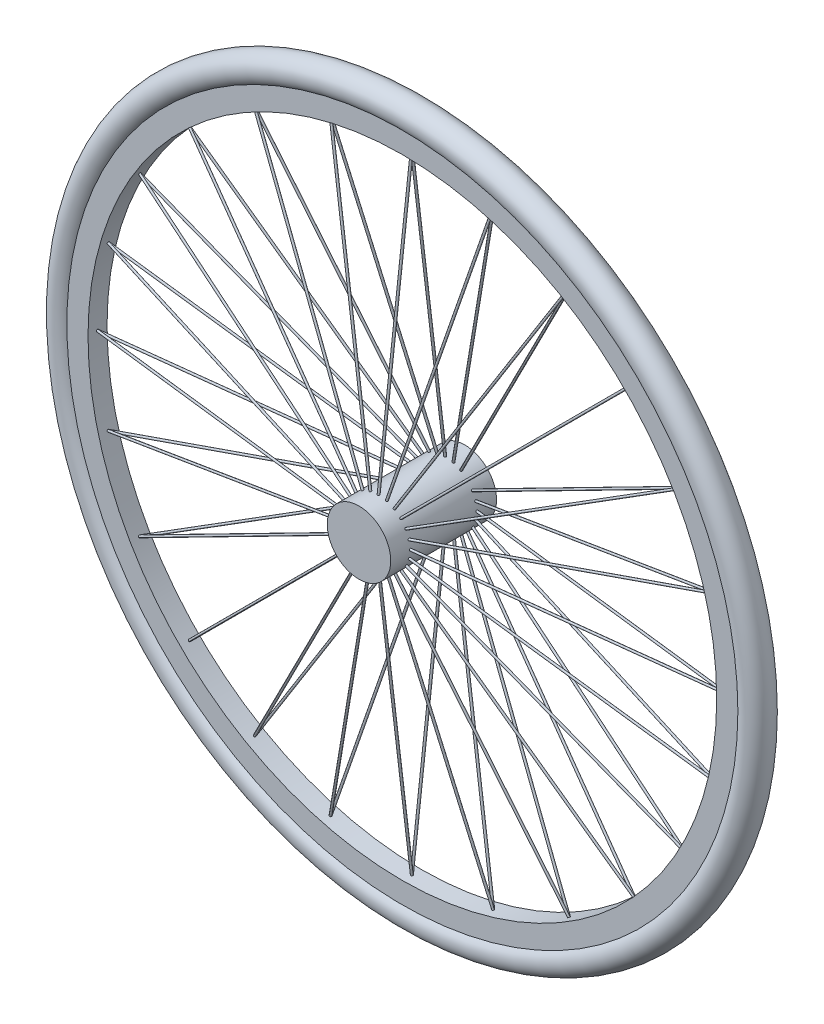
from build123d import *

# Parameters (mm, degrees)
SKETCH_1_R                  = 30
EXTRUDE_1_DEPTH             = 50
EXTRUDE_2_REACH             = 490.288
EXTRUDE_2_END_RADIUS        = 297.143913836
SKETCH_6_R                  = 1
PATTERN_CIRCULAR_1_COUNT    = 24
MIRROR_1_COPY_1_REACH       = 490.288
MIRROR_1_COPY_1_END_RADIUS  = 297.143913836
MIRROR_1_COPY_1_SKETCH_R    = 1
MIRROR_1_COPY_2_REACH       = 490.288
MIRROR_1_COPY_2_END_RADIUS  = 297.143913836
MIRROR_1_COPY_2_SKETCH_R    = 1
MIRROR_1_COPY_3_REACH       = 490.288
MIRROR_1_COPY_3_END_RADIUS  = 297.143913836
MIRROR_1_COPY_3_SKETCH_R    = 1
MIRROR_1_COPY_4_REACH       = 490.288
MIRROR_1_COPY_4_END_RADIUS  = 297.143913836
MIRROR_1_COPY_4_SKETCH_R    = 1
MIRROR_1_COPY_5_REACH       = 490.288
MIRROR_1_COPY_5_END_RADIUS  = 297.143913836
MIRROR_1_COPY_5_SKETCH_R    = 1
MIRROR_1_COPY_6_REACH       = 490.288
MIRROR_1_COPY_6_END_RADIUS  = 297.143913836
MIRROR_1_COPY_6_SKETCH_R    = 1
MIRROR_1_COPY_7_REACH       = 490.288
MIRROR_1_COPY_7_END_RADIUS  = 297.143913836
MIRROR_1_COPY_7_SKETCH_R    = 1
MIRROR_1_COPY_8_REACH       = 490.288
MIRROR_1_COPY_8_END_RADIUS  = 297.143913836
MIRROR_1_COPY_8_SKETCH_R    = 1
MIRROR_1_COPY_9_REACH       = 490.288
MIRROR_1_COPY_9_END_RADIUS  = 297.143913836
MIRROR_1_COPY_9_SKETCH_R    = 1
MIRROR_1_COPY_10_REACH      = 490.288
MIRROR_1_COPY_10_END_RADIUS = 297.143913836
MIRROR_1_COPY_10_SKETCH_R   = 1
MIRROR_1_COPY_11_REACH      = 490.288
MIRROR_1_COPY_11_END_RADIUS = 297.143913836
MIRROR_1_COPY_11_SKETCH_R   = 1
MIRROR_1_COPY_12_REACH      = 490.288
MIRROR_1_COPY_12_END_RADIUS = 297.143913836
MIRROR_1_COPY_12_SKETCH_R   = 1
MIRROR_1_COPY_13_REACH      = 490.288
MIRROR_1_COPY_13_END_RADIUS = 297.143913836
MIRROR_1_COPY_13_SKETCH_R   = 1
MIRROR_1_COPY_14_REACH      = 490.288
MIRROR_1_COPY_14_END_RADIUS = 297.143913836
MIRROR_1_COPY_14_SKETCH_R   = 1
MIRROR_1_COPY_15_REACH      = 490.288
MIRROR_1_COPY_15_END_RADIUS = 297.143913836
MIRROR_1_COPY_15_SKETCH_R   = 1
MIRROR_1_COPY_16_REACH      = 490.288
MIRROR_1_COPY_16_END_RADIUS = 297.143913836
MIRROR_1_COPY_16_SKETCH_R   = 1
MIRROR_1_COPY_17_REACH      = 490.288
MIRROR_1_COPY_17_END_RADIUS = 297.143913836
MIRROR_1_COPY_17_SKETCH_R   = 1
MIRROR_1_COPY_18_REACH      = 490.288
MIRROR_1_COPY_18_END_RADIUS = 297.143913836
MIRROR_1_COPY_18_SKETCH_R   = 1
MIRROR_1_COPY_19_REACH      = 490.288
MIRROR_1_COPY_19_END_RADIUS = 297.143913836
MIRROR_1_COPY_19_SKETCH_R   = 1
MIRROR_1_COPY_20_REACH      = 490.288
MIRROR_1_COPY_20_END_RADIUS = 297.143913836
MIRROR_1_COPY_20_SKETCH_R   = 1
MIRROR_1_COPY_21_REACH      = 490.288
MIRROR_1_COPY_21_END_RADIUS = 297.143913836
MIRROR_1_COPY_21_SKETCH_R   = 1
MIRROR_1_COPY_22_REACH      = 490.288
MIRROR_1_COPY_22_END_RADIUS = 297.143913836
MIRROR_1_COPY_22_SKETCH_R   = 1
MIRROR_1_COPY_23_REACH      = 490.288
MIRROR_1_COPY_23_END_RADIUS = 297.143913836
MIRROR_1_COPY_23_SKETCH_R   = 1
MIRROR_1_COPY_24_REACH      = 490.288
MIRROR_1_COPY_24_END_RADIUS = 297.143913836
MIRROR_1_COPY_24_SKETCH_R   = 1


with BuildPart() as part:
    # 草图1 → 凸台-拉伸1 (new, symmetric)
    with BuildSketch(Plane.XY):
        Circle(SKETCH_1_R)
    extrude(amount=EXTRUDE_1_DEPTH, both=True)



with BuildPart() as body_2:
    # 草图2 → 旋转1 (revolve)
    with BuildSketch(Plane(origin=(0, 0, 0), x_dir=(1, 0, 0), z_dir=(0, 1, 0))):
        with BuildLine():
            Line((297.143913836, 9), (317.143913836, 9))
            ThreePointArc((317.143913836, 9), (340, 0), (317.143913836, -9))
            Line((317.143913836, -9), (297.143913836, -9))
            Line((297.143913836, -9), (297.143913836, 9))
        make_face()
    revolve(axis=Axis((0, 0, 50), (0, 0, -1)))


with BuildPart() as part_1:
    add(part.part)

    add(body_2.part)  # 凸台-拉伸2 merges body 2
    # 凸台-拉伸2: up to this cylinder (the profile starts inside it)
    extrude_2_end = Plane(origin=(0, 0, 35), z_dir=(0, 0, 1)) * Cylinder(EXTRUDE_2_END_RADIUS, 1575.863827673, mode=Mode.PRIVATE)
    # 草图6 → 凸台-拉伸2 (add, up to the surface)
    with BuildSketch(Plane(origin=(0, 0, 35), x_dir=(-0.11697935085130698, 0, -0.9931343471426245), z_dir=(0.9931343471426245, 0, -0.11697935085130698)), mode=Mode.PRIVATE) as extrude_2_sk1:
        Circle(SKETCH_6_R)
    extrude_2_tool1 = extrude(extrude_2_sk1.sketch, amount=EXTRUDE_2_REACH, mode=Mode.PRIVATE) & extrude_2_end
    extrude_2 = extrude_2_tool1.solids().sort_by_distance((0, 0, 35))[0]
    add(extrude_2)

    # 阵列(圆周)1: 凸台-拉伸2 ×24 about axis
    pattern_circular_1_axis = Axis((0, 0, 50), (0, 0, 1))
    for i in range(1, PATTERN_CIRCULAR_1_COUNT):
        add(extrude_2.rotate(pattern_circular_1_axis, i * 360 / PATTERN_CIRCULAR_1_COUNT))

    # 镜向1 copy 1: up to this cylinder (the profile starts inside it)
    mirror_1_copy_1_end = Plane(origin=(0, 0, 35), z_dir=(0, 0, 1)) * Cylinder(MIRROR_1_COPY_1_END_RADIUS, 1575.863827673, mode=Mode.PRIVATE)
    # 镜向1 copy 1 sketch → 镜向1 copy 1 (add, up to the surface)
    with BuildSketch(Plane(origin=(0, 0, -35), x_dir=(-0.11299337612980752, -0.03027648388404802, 0.9931343471426245), z_dir=(0.959294114879794, 0.2570420833859694, 0.11697935085130698)), mode=Mode.PRIVATE) as mirror_1_copy_1_sk1:
        Circle(MIRROR_1_COPY_1_SKETCH_R)
    mirror_1_copy_1_tool1 = extrude(mirror_1_copy_1_sk1.sketch, amount=MIRROR_1_COPY_1_REACH, mode=Mode.PRIVATE) & mirror_1_copy_1_end
    add(mirror_1_copy_1_tool1.solids().sort_by_distance((0, 0, 35))[0])

    # 镜向1 copy 2: up to this cylinder (the profile starts inside it)
    mirror_1_copy_2_end = Plane(origin=(0, 0, 35), z_dir=(0, 0, 1)) * Cylinder(MIRROR_1_COPY_2_END_RADIUS, 1575.863827673, mode=Mode.PRIVATE)
    # 镜向1 copy 2 sketch → 镜向1 copy 2 (add, up to the surface)
    with BuildSketch(Plane(origin=(0, 0, -35), x_dir=(-0.10130708955544465, -0.05848967542565348, 0.9931343471426245), z_dir=(0.8600795739963863, 0.4965671735713122, 0.11697935085130698)), mode=Mode.PRIVATE) as mirror_1_copy_2_sk1:
        Circle(MIRROR_1_COPY_2_SKETCH_R)
    mirror_1_copy_2_tool1 = extrude(mirror_1_copy_2_sk1.sketch, amount=MIRROR_1_COPY_2_REACH, mode=Mode.PRIVATE) & mirror_1_copy_2_end
    add(mirror_1_copy_2_tool1.solids().sort_by_distance((0, 0, 35))[0])

    # 镜向1 copy 3: up to this cylinder (the profile starts inside it)
    mirror_1_copy_3_end = Plane(origin=(0, 0, 35), z_dir=(0, 0, 1)) * Cylinder(MIRROR_1_COPY_3_END_RADIUS, 1575.863827673, mode=Mode.PRIVATE)
    # 镜向1 copy 3 sketch → 镜向1 copy 3 (add, up to the surface)
    with BuildSketch(Plane(origin=(0, 0, -35), x_dir=(-0.0827168922457595, -0.08271689224575948, 0.9931343471426245), z_dir=(0.7022520314938245, 0.7022520314938244, 0.11697935085130698)), mode=Mode.PRIVATE) as mirror_1_copy_3_sk1:
        Circle(MIRROR_1_COPY_3_SKETCH_R)
    mirror_1_copy_3_tool1 = extrude(mirror_1_copy_3_sk1.sketch, amount=MIRROR_1_COPY_3_REACH, mode=Mode.PRIVATE) & mirror_1_copy_3_end
    add(mirror_1_copy_3_tool1.solids().sort_by_distance((0, 0, 35))[0])

    # 镜向1 copy 4: up to this cylinder (the profile starts inside it)
    mirror_1_copy_4_end = Plane(origin=(0, 0, 35), z_dir=(0, 0, 1)) * Cylinder(MIRROR_1_COPY_4_END_RADIUS, 1575.863827673, mode=Mode.PRIVATE)
    # 镜向1 copy 4 sketch → 镜向1 copy 4 (add, up to the surface)
    with BuildSketch(Plane(origin=(0, 0, -35), x_dir=(-0.0584896754256535, -0.10130708955544464, 0.9931343471426245), z_dir=(0.49656717357131236, 0.8600795739963862, 0.11697935085130698)), mode=Mode.PRIVATE) as mirror_1_copy_4_sk1:
        Circle(MIRROR_1_COPY_4_SKETCH_R)
    mirror_1_copy_4_tool1 = extrude(mirror_1_copy_4_sk1.sketch, amount=MIRROR_1_COPY_4_REACH, mode=Mode.PRIVATE) & mirror_1_copy_4_end
    add(mirror_1_copy_4_tool1.solids().sort_by_distance((0, 0, 35))[0])

    # 镜向1 copy 5: up to this cylinder (the profile starts inside it)
    mirror_1_copy_5_end = Plane(origin=(0, 0, 35), z_dir=(0, 0, 1)) * Cylinder(MIRROR_1_COPY_5_END_RADIUS, 1575.863827673, mode=Mode.PRIVATE)
    # 镜向1 copy 5 sketch → 镜向1 copy 5 (add, up to the surface)
    with BuildSketch(Plane(origin=(0, 0, -35), x_dir=(-0.03027648388404802, -0.11299337612980752, 0.9931343471426245), z_dir=(0.2570420833859694, 0.959294114879794, 0.11697935085130698)), mode=Mode.PRIVATE) as mirror_1_copy_5_sk1:
        Circle(MIRROR_1_COPY_5_SKETCH_R)
    mirror_1_copy_5_tool1 = extrude(mirror_1_copy_5_sk1.sketch, amount=MIRROR_1_COPY_5_REACH, mode=Mode.PRIVATE) & mirror_1_copy_5_end
    add(mirror_1_copy_5_tool1.solids().sort_by_distance((0, 0, 35))[0])

    # 镜向1 copy 6: up to this cylinder (the profile starts inside it)
    mirror_1_copy_6_end = Plane(origin=(0, 0, 35), z_dir=(0, 0, 1)) * Cylinder(MIRROR_1_COPY_6_END_RADIUS, 1575.863827673, mode=Mode.PRIVATE)
    # 镜向1 copy 6 sketch → 镜向1 copy 6 (add, up to the surface)
    with BuildSketch(Plane(origin=(0, 0, -35), x_dir=(0, -0.11697935085130698, 0.9931343471426245), z_dir=(0, 0.9931343471426245, 0.11697935085130698)), mode=Mode.PRIVATE) as mirror_1_copy_6_sk1:
        Circle(MIRROR_1_COPY_6_SKETCH_R)
    mirror_1_copy_6_tool1 = extrude(mirror_1_copy_6_sk1.sketch, amount=MIRROR_1_COPY_6_REACH, mode=Mode.PRIVATE) & mirror_1_copy_6_end
    add(mirror_1_copy_6_tool1.solids().sort_by_distance((0, 0, 35))[0])

    # 镜向1 copy 7: up to this cylinder (the profile starts inside it)
    mirror_1_copy_7_end = Plane(origin=(0, 0, 35), z_dir=(0, 0, 1)) * Cylinder(MIRROR_1_COPY_7_END_RADIUS, 1575.863827673, mode=Mode.PRIVATE)
    # 镜向1 copy 7 sketch → 镜向1 copy 7 (add, up to the surface)
    with BuildSketch(Plane(origin=(0, 0, -35), x_dir=(0.030276483884048033, -0.11299337612980752, 0.9931343471426244), z_dir=(-0.2570420833859695, 0.959294114879794, 0.11697935085130697)), mode=Mode.PRIVATE) as mirror_1_copy_7_sk1:
        Circle(MIRROR_1_COPY_7_SKETCH_R)
    mirror_1_copy_7_tool1 = extrude(mirror_1_copy_7_sk1.sketch, amount=MIRROR_1_COPY_7_REACH, mode=Mode.PRIVATE) & mirror_1_copy_7_end
    add(mirror_1_copy_7_tool1.solids().sort_by_distance((0, 0, 35))[0])

    # 镜向1 copy 8: up to this cylinder (the profile starts inside it)
    mirror_1_copy_8_end = Plane(origin=(0, 0, 35), z_dir=(0, 0, 1)) * Cylinder(MIRROR_1_COPY_8_END_RADIUS, 1575.863827673, mode=Mode.PRIVATE)
    # 镜向1 copy 8 sketch → 镜向1 copy 8 (add, up to the surface)
    with BuildSketch(Plane(origin=(0, 0, -35), x_dir=(0.05848967542565346, -0.10130708955544465, 0.9931343471426245), z_dir=(-0.496567173571312, 0.8600795739963863, 0.11697935085130698)), mode=Mode.PRIVATE) as mirror_1_copy_8_sk1:
        Circle(MIRROR_1_COPY_8_SKETCH_R)
    mirror_1_copy_8_tool1 = extrude(mirror_1_copy_8_sk1.sketch, amount=MIRROR_1_COPY_8_REACH, mode=Mode.PRIVATE) & mirror_1_copy_8_end
    add(mirror_1_copy_8_tool1.solids().sort_by_distance((0, 0, 35))[0])

    # 镜向1 copy 9: up to this cylinder (the profile starts inside it)
    mirror_1_copy_9_end = Plane(origin=(0, 0, 35), z_dir=(0, 0, 1)) * Cylinder(MIRROR_1_COPY_9_END_RADIUS, 1575.863827673, mode=Mode.PRIVATE)
    # 镜向1 copy 9 sketch → 镜向1 copy 9 (add, up to the surface)
    with BuildSketch(Plane(origin=(0, 0, -35), x_dir=(0.08271689224575948, -0.0827168922457595, 0.9931343471426245), z_dir=(-0.7022520314938244, 0.7022520314938245, 0.11697935085130698)), mode=Mode.PRIVATE) as mirror_1_copy_9_sk1:
        Circle(MIRROR_1_COPY_9_SKETCH_R)
    mirror_1_copy_9_tool1 = extrude(mirror_1_copy_9_sk1.sketch, amount=MIRROR_1_COPY_9_REACH, mode=Mode.PRIVATE) & mirror_1_copy_9_end
    add(mirror_1_copy_9_tool1.solids().sort_by_distance((0, 0, 35))[0])

    # 镜向1 copy 10: up to this cylinder (the profile starts inside it)
    mirror_1_copy_10_end = Plane(origin=(0, 0, 35), z_dir=(0, 0, 1)) * Cylinder(MIRROR_1_COPY_10_END_RADIUS, 1575.863827673, mode=Mode.PRIVATE)
    # 镜向1 copy 10 sketch → 镜向1 copy 10 (add, up to the surface)
    with BuildSketch(Plane(origin=(0, 0, -35), x_dir=(0.10130708955544465, -0.05848967542565348, 0.9931343471426245), z_dir=(-0.8600795739963863, 0.4965671735713122, 0.11697935085130698)), mode=Mode.PRIVATE) as mirror_1_copy_10_sk1:
        Circle(MIRROR_1_COPY_10_SKETCH_R)
    mirror_1_copy_10_tool1 = extrude(mirror_1_copy_10_sk1.sketch, amount=MIRROR_1_COPY_10_REACH, mode=Mode.PRIVATE) & mirror_1_copy_10_end
    add(mirror_1_copy_10_tool1.solids().sort_by_distance((0, 0, 35))[0])

    # 镜向1 copy 11: up to this cylinder (the profile starts inside it)
    mirror_1_copy_11_end = Plane(origin=(0, 0, 35), z_dir=(0, 0, 1)) * Cylinder(MIRROR_1_COPY_11_END_RADIUS, 1575.863827673, mode=Mode.PRIVATE)
    # 镜向1 copy 11 sketch → 镜向1 copy 11 (add, up to the surface)
    with BuildSketch(Plane(origin=(0, 0, -35), x_dir=(0.1129933761298075, -0.03027648388404805, 0.9931343471426245), z_dir=(-0.9592941148797939, 0.2570420833859697, 0.11697935085130698)), mode=Mode.PRIVATE) as mirror_1_copy_11_sk1:
        Circle(MIRROR_1_COPY_11_SKETCH_R)
    mirror_1_copy_11_tool1 = extrude(mirror_1_copy_11_sk1.sketch, amount=MIRROR_1_COPY_11_REACH, mode=Mode.PRIVATE) & mirror_1_copy_11_end
    add(mirror_1_copy_11_tool1.solids().sort_by_distance((0, 0, 35))[0])

    # 镜向1 copy 12: up to this cylinder (the profile starts inside it)
    mirror_1_copy_12_end = Plane(origin=(0, 0, 35), z_dir=(0, 0, 1)) * Cylinder(MIRROR_1_COPY_12_END_RADIUS, 1575.863827673, mode=Mode.PRIVATE)
    # 镜向1 copy 12 sketch → 镜向1 copy 12 (add, up to the surface)
    with BuildSketch(Plane(origin=(0, 0, -35), x_dir=(0.11697935085130698, 0, 0.9931343471426245), z_dir=(-0.9931343471426245, 0, 0.11697935085130698)), mode=Mode.PRIVATE) as mirror_1_copy_12_sk1:
        Circle(MIRROR_1_COPY_12_SKETCH_R)
    mirror_1_copy_12_tool1 = extrude(mirror_1_copy_12_sk1.sketch, amount=MIRROR_1_COPY_12_REACH, mode=Mode.PRIVATE) & mirror_1_copy_12_end
    add(mirror_1_copy_12_tool1.solids().sort_by_distance((0, 0, 35))[0])

    # 镜向1 copy 13: up to this cylinder (the profile starts inside it)
    mirror_1_copy_13_end = Plane(origin=(0, 0, 35), z_dir=(0, 0, 1)) * Cylinder(MIRROR_1_COPY_13_END_RADIUS, 1575.863827673, mode=Mode.PRIVATE)
    # 镜向1 copy 13 sketch → 镜向1 copy 13 (add, up to the surface)
    with BuildSketch(Plane(origin=(0, 0, -35), x_dir=(0.11299337612980752, 0.030276483884048026, 0.9931343471426244), z_dir=(-0.959294114879794, -0.25704208338596946, 0.11697935085130697)), mode=Mode.PRIVATE) as mirror_1_copy_13_sk1:
        Circle(MIRROR_1_COPY_13_SKETCH_R)
    mirror_1_copy_13_tool1 = extrude(mirror_1_copy_13_sk1.sketch, amount=MIRROR_1_COPY_13_REACH, mode=Mode.PRIVATE) & mirror_1_copy_13_end
    add(mirror_1_copy_13_tool1.solids().sort_by_distance((0, 0, 35))[0])

    # 镜向1 copy 14: up to this cylinder (the profile starts inside it)
    mirror_1_copy_14_end = Plane(origin=(0, 0, 35), z_dir=(0, 0, 1)) * Cylinder(MIRROR_1_COPY_14_END_RADIUS, 1575.863827673, mode=Mode.PRIVATE)
    # 镜向1 copy 14 sketch → 镜向1 copy 14 (add, up to the surface)
    with BuildSketch(Plane(origin=(0, 0, -35), x_dir=(0.10130708955544464, 0.0584896754256535, 0.9931343471426245), z_dir=(-0.8600795739963862, -0.49656717357131236, 0.11697935085130698)), mode=Mode.PRIVATE) as mirror_1_copy_14_sk1:
        Circle(MIRROR_1_COPY_14_SKETCH_R)
    mirror_1_copy_14_tool1 = extrude(mirror_1_copy_14_sk1.sketch, amount=MIRROR_1_COPY_14_REACH, mode=Mode.PRIVATE) & mirror_1_copy_14_end
    add(mirror_1_copy_14_tool1.solids().sort_by_distance((0, 0, 35))[0])

    # 镜向1 copy 15: up to this cylinder (the profile starts inside it)
    mirror_1_copy_15_end = Plane(origin=(0, 0, 35), z_dir=(0, 0, 1)) * Cylinder(MIRROR_1_COPY_15_END_RADIUS, 1575.863827673, mode=Mode.PRIVATE)
    # 镜向1 copy 15 sketch → 镜向1 copy 15 (add, up to the surface)
    with BuildSketch(Plane(origin=(0, 0, -35), x_dir=(0.08271689224575951, 0.08271689224575948, 0.9931343471426245), z_dir=(-0.7022520314938246, -0.7022520314938244, 0.11697935085130698)), mode=Mode.PRIVATE) as mirror_1_copy_15_sk1:
        Circle(MIRROR_1_COPY_15_SKETCH_R)
    mirror_1_copy_15_tool1 = extrude(mirror_1_copy_15_sk1.sketch, amount=MIRROR_1_COPY_15_REACH, mode=Mode.PRIVATE) & mirror_1_copy_15_end
    add(mirror_1_copy_15_tool1.solids().sort_by_distance((0, 0, 35))[0])

    # 镜向1 copy 16: up to this cylinder (the profile starts inside it)
    mirror_1_copy_16_end = Plane(origin=(0, 0, 35), z_dir=(0, 0, 1)) * Cylinder(MIRROR_1_COPY_16_END_RADIUS, 1575.863827673, mode=Mode.PRIVATE)
    # 镜向1 copy 16 sketch → 镜向1 copy 16 (add, up to the surface)
    with BuildSketch(Plane(origin=(0, 0, -35), x_dir=(0.05848967542565354, 0.10130708955544461, 0.9931343471426245), z_dir=(-0.4965671735713127, -0.860079573996386, 0.11697935085130698)), mode=Mode.PRIVATE) as mirror_1_copy_16_sk1:
        Circle(MIRROR_1_COPY_16_SKETCH_R)
    mirror_1_copy_16_tool1 = extrude(mirror_1_copy_16_sk1.sketch, amount=MIRROR_1_COPY_16_REACH, mode=Mode.PRIVATE) & mirror_1_copy_16_end
    add(mirror_1_copy_16_tool1.solids().sort_by_distance((0, 0, 35))[0])

    # 镜向1 copy 17: up to this cylinder (the profile starts inside it)
    mirror_1_copy_17_end = Plane(origin=(0, 0, 35), z_dir=(0, 0, 1)) * Cylinder(MIRROR_1_COPY_17_END_RADIUS, 1575.863827673, mode=Mode.PRIVATE)
    # 镜向1 copy 17 sketch → 镜向1 copy 17 (add, up to the surface)
    with BuildSketch(Plane(origin=(0, 0, -35), x_dir=(0.030276483884048005, 0.11299337612980752, 0.9931343471426245), z_dir=(-0.2570420833859693, -0.959294114879794, 0.11697935085130698)), mode=Mode.PRIVATE) as mirror_1_copy_17_sk1:
        Circle(MIRROR_1_COPY_17_SKETCH_R)
    mirror_1_copy_17_tool1 = extrude(mirror_1_copy_17_sk1.sketch, amount=MIRROR_1_COPY_17_REACH, mode=Mode.PRIVATE) & mirror_1_copy_17_end
    add(mirror_1_copy_17_tool1.solids().sort_by_distance((0, 0, 35))[0])

    # 镜向1 copy 18: up to this cylinder (the profile starts inside it)
    mirror_1_copy_18_end = Plane(origin=(0, 0, 35), z_dir=(0, 0, 1)) * Cylinder(MIRROR_1_COPY_18_END_RADIUS, 1575.863827673, mode=Mode.PRIVATE)
    # 镜向1 copy 18 sketch → 镜向1 copy 18 (add, up to the surface)
    with BuildSketch(Plane(origin=(0, 0, -35), x_dir=(0, 0.11697935085130698, 0.9931343471426245), z_dir=(0, -0.9931343471426245, 0.11697935085130698)), mode=Mode.PRIVATE) as mirror_1_copy_18_sk1:
        Circle(MIRROR_1_COPY_18_SKETCH_R)
    mirror_1_copy_18_tool1 = extrude(mirror_1_copy_18_sk1.sketch, amount=MIRROR_1_COPY_18_REACH, mode=Mode.PRIVATE) & mirror_1_copy_18_end
    add(mirror_1_copy_18_tool1.solids().sort_by_distance((0, 0, 35))[0])

    # 镜向1 copy 19: up to this cylinder (the profile starts inside it)
    mirror_1_copy_19_end = Plane(origin=(0, 0, 35), z_dir=(0, 0, 1)) * Cylinder(MIRROR_1_COPY_19_END_RADIUS, 1575.863827673, mode=Mode.PRIVATE)
    # 镜向1 copy 19 sketch → 镜向1 copy 19 (add, up to the surface)
    with BuildSketch(Plane(origin=(0, 0, -35), x_dir=(-0.030276483884047967, 0.11299337612980753, 0.9931343471426245), z_dir=(0.25704208338596896, -0.9592941148797941, 0.11697935085130698)), mode=Mode.PRIVATE) as mirror_1_copy_19_sk1:
        Circle(MIRROR_1_COPY_19_SKETCH_R)
    mirror_1_copy_19_tool1 = extrude(mirror_1_copy_19_sk1.sketch, amount=MIRROR_1_COPY_19_REACH, mode=Mode.PRIVATE) & mirror_1_copy_19_end
    add(mirror_1_copy_19_tool1.solids().sort_by_distance((0, 0, 35))[0])

    # 镜向1 copy 20: up to this cylinder (the profile starts inside it)
    mirror_1_copy_20_end = Plane(origin=(0, 0, 35), z_dir=(0, 0, 1)) * Cylinder(MIRROR_1_COPY_20_END_RADIUS, 1575.863827673, mode=Mode.PRIVATE)
    # 镜向1 copy 20 sketch → 镜向1 copy 20 (add, up to the surface)
    with BuildSketch(Plane(origin=(0, 0, -35), x_dir=(-0.0584896754256535, 0.10130708955544464, 0.9931343471426245), z_dir=(0.49656717357131236, -0.8600795739963862, 0.11697935085130698)), mode=Mode.PRIVATE) as mirror_1_copy_20_sk1:
        Circle(MIRROR_1_COPY_20_SKETCH_R)
    mirror_1_copy_20_tool1 = extrude(mirror_1_copy_20_sk1.sketch, amount=MIRROR_1_COPY_20_REACH, mode=Mode.PRIVATE) & mirror_1_copy_20_end
    add(mirror_1_copy_20_tool1.solids().sort_by_distance((0, 0, 35))[0])

    # 镜向1 copy 21: up to this cylinder (the profile starts inside it)
    mirror_1_copy_21_end = Plane(origin=(0, 0, 35), z_dir=(0, 0, 1)) * Cylinder(MIRROR_1_COPY_21_END_RADIUS, 1575.863827673, mode=Mode.PRIVATE)
    # 镜向1 copy 21 sketch → 镜向1 copy 21 (add, up to the surface)
    with BuildSketch(Plane(origin=(0, 0, -35), x_dir=(-0.08271689224575948, 0.08271689224575951, 0.9931343471426245), z_dir=(0.7022520314938243, -0.7022520314938246, 0.11697935085130698)), mode=Mode.PRIVATE) as mirror_1_copy_21_sk1:
        Circle(MIRROR_1_COPY_21_SKETCH_R)
    mirror_1_copy_21_tool1 = extrude(mirror_1_copy_21_sk1.sketch, amount=MIRROR_1_COPY_21_REACH, mode=Mode.PRIVATE) & mirror_1_copy_21_end
    add(mirror_1_copy_21_tool1.solids().sort_by_distance((0, 0, 35))[0])

    # 镜向1 copy 22: up to this cylinder (the profile starts inside it)
    mirror_1_copy_22_end = Plane(origin=(0, 0, 35), z_dir=(0, 0, 1)) * Cylinder(MIRROR_1_COPY_22_END_RADIUS, 1575.863827673, mode=Mode.PRIVATE)
    # 镜向1 copy 22 sketch → 镜向1 copy 22 (add, up to the surface)
    with BuildSketch(Plane(origin=(0, 0, -35), x_dir=(-0.10130708955544461, 0.05848967542565354, 0.9931343471426245), z_dir=(0.860079573996386, -0.4965671735713127, 0.11697935085130698)), mode=Mode.PRIVATE) as mirror_1_copy_22_sk1:
        Circle(MIRROR_1_COPY_22_SKETCH_R)
    mirror_1_copy_22_tool1 = extrude(mirror_1_copy_22_sk1.sketch, amount=MIRROR_1_COPY_22_REACH, mode=Mode.PRIVATE) & mirror_1_copy_22_end
    add(mirror_1_copy_22_tool1.solids().sort_by_distance((0, 0, 35))[0])

    # 镜向1 copy 23: up to this cylinder (the profile starts inside it)
    mirror_1_copy_23_end = Plane(origin=(0, 0, 35), z_dir=(0, 0, 1)) * Cylinder(MIRROR_1_COPY_23_END_RADIUS, 1575.863827673, mode=Mode.PRIVATE)
    # 镜向1 copy 23 sketch → 镜向1 copy 23 (add, up to the surface)
    with BuildSketch(Plane(origin=(0, 0, -35), x_dir=(-0.11299337612980752, 0.030276483884048012, 0.9931343471426245), z_dir=(0.959294114879794, -0.25704208338596934, 0.11697935085130698)), mode=Mode.PRIVATE) as mirror_1_copy_23_sk1:
        Circle(MIRROR_1_COPY_23_SKETCH_R)
    mirror_1_copy_23_tool1 = extrude(mirror_1_copy_23_sk1.sketch, amount=MIRROR_1_COPY_23_REACH, mode=Mode.PRIVATE) & mirror_1_copy_23_end
    add(mirror_1_copy_23_tool1.solids().sort_by_distance((0, 0, 35))[0])

    # 镜向1 copy 24: up to this cylinder (the profile starts inside it)
    mirror_1_copy_24_end = Plane(origin=(0, 0, 35), z_dir=(0, 0, 1)) * Cylinder(MIRROR_1_COPY_24_END_RADIUS, 1575.863827673, mode=Mode.PRIVATE)
    # 镜向1 copy 24 sketch → 镜向1 copy 24 (add, up to the surface)
    with BuildSketch(Plane(origin=(0, 0, -35), x_dir=(-0.11697935085130698, 0, 0.9931343471426245), z_dir=(0.9931343471426245, 0, 0.11697935085130698)), mode=Mode.PRIVATE) as mirror_1_copy_24_sk1:
        Circle(MIRROR_1_COPY_24_SKETCH_R)
    mirror_1_copy_24_tool1 = extrude(mirror_1_copy_24_sk1.sketch, amount=MIRROR_1_COPY_24_REACH, mode=Mode.PRIVATE) & mirror_1_copy_24_end
    add(mirror_1_copy_24_tool1.solids().sort_by_distance((0, 0, 35))[0])


solid = part_1.part
